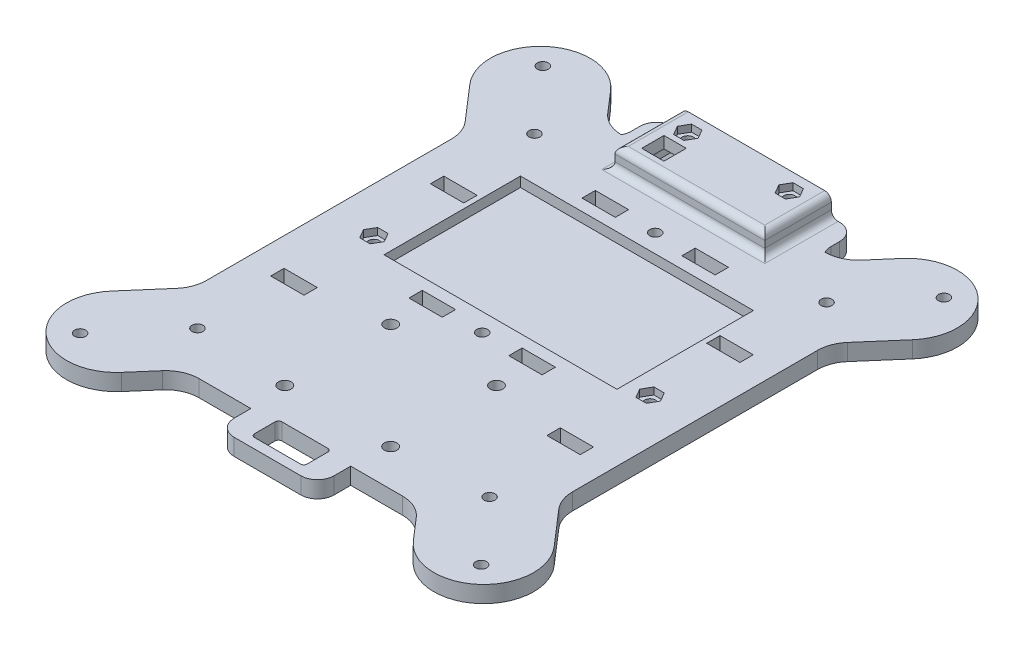
from build123d import *

# Parameters (mm, degrees)
SKETCH1_W                  = 110
SKETCH1_H                  = 126.923076924
BOSS_EXTRUDE1_DEPTH        = 5
CUT_EXTRUDE1_DEPTH         = 2.1
F_3_3_3_3_DIAMETER_HOLE1_D = 3.3
SKETCH30_W                 = 60
SKETCH30_H                 = 10
BOSS_EXTRUDE6_DEPTH        = 5
SKETCH9_W                  = 45
SKETCH9_H                  = 20
BOSS_EXTRUDE2_DEPTH        = 6
FILLET1_RADIUS             = 15
FILLET1_LENGTH             = 5
FILLET2_RADIUS             = 15
FILLET2_LENGTH             = 5
FILLET3_RADIUS             = 15
FILLET3_LENGTH             = 5
FILLET4_RADIUS             = 15
FILLET4_LENGTH             = 5
FILLET5_R                  = 10
SKETCH16_W                 = 41
SKETCH16_H                 = 16
CUT_EXTRUDE13_DEPTH        = 7.5
SKETCH18_R                 = 1.7
SKETCH18_W                 = 6.7
SKETCH18_H                 = 6.7
CUT_EXTRUDE14_DEPTH        = 3.5
FILLET8_R                  = 2
FILLET9_R                  = 2
CUT_EXTRUDE20_REACH        = 169.893
BOSS_EXTRUDE7_DEPTH        = 16
CUT_EXTRUDE17_DEPTH        = 2.1
SKETCH28_W                 = 30
SKETCH28_H                 = 10
BOSS_EXTRUDE4_DEPTH        = 5
FILLET11_R                 = 5
SKETCH25_R                 = 1.9
SKETCH25_W                 = 15.8
SKETCH25_H                 = 8.2
CUT_EXTRUDE18_DEPTH        = 5
FILLET12_R                 = 1
FILLET13_R                 = 5
SKETCH32_W                 = 70
SKETCH32_H                 = 41
CUT_EXTRUDE25_DEPTH        = 3
SKETCH43_R                 = 1.65
SKETCH43_W                 = 10
SKETCH43_H                 = 4
CUT_EXTRUDE26_DEPTH        = 5
CUT_EXTRUDE27_DEPTH        = 2.1
SKETCH48_R                 = 1.65
SKETCH48_W                 = 10
SKETCH48_H                 = 4
CUT_EXTRUDE28_DEPTH        = 5
CUT_EXTRUDE29_DEPTH        = 2.1


with BuildPart() as part:
    # Sketch1 → Boss-Extrude1 (new body)
    with BuildSketch(Plane(origin=(0, 0, 0), x_dir=(1, 0, 0), z_dir=(0, 1, 0))):
        Polygon((-76.335336242, 65.176041924), (-53.664663758, 84.823958076), (76.335336242, -65.176041924), (53.664663758, -84.823958076), align=None)
        Rectangle(SKETCH1_W, SKETCH1_H)
        Polygon((53.664663758, 84.823958076), (76.335336242, 65.176041924), (-53.664663758, -84.823958076), (-76.335336242, -65.176041924), align=None)
    extrude(amount=BOSS_EXTRUDE1_DEPTH)

    # Sketch2 → Cut-Extrude1 (cut)
    with BuildSketch(Plane.XZ):
        Polygon((-61.273034387, -66.577080465), (-63.314905729, -68.93308586), (-62.295480877, -71.879401012), (-59.234184682, -72.469710768), (-57.19231334, -70.113705373), (-58.211738192, -67.167390222), align=None)
        Polygon((-41.838474732, -48.275163152), (-44.899770926, -47.684853396), (-46.941642269, -50.040858791), (-45.922217416, -52.987173942), (-42.860921222, -53.577483698), (-40.819049879, -51.221478303), align=None)
        Polygon((44.899770926, -47.684853396), (41.838474732, -48.275163152), (40.819049879, -51.221478303), (42.860921222, -53.577483698), (45.922217416, -52.987173942), (46.941642269, -50.040858791), align=None)
        Polygon((58.211738192, -67.167390222), (57.19231334, -70.113705373), (59.234184682, -72.469710768), (62.295480877, -71.879401012), (63.314905729, -68.93308586), (61.273034387, -66.577080465), align=None)
        Polygon((62.295480877, 71.879401012), (59.234184682, 72.469710768), (57.19231334, 70.113705373), (58.211738192, 67.167390222), (61.273034387, 66.577080465), (63.314905729, 68.93308586), align=None)
        Polygon((42.860921222, 53.577483698), (40.819049879, 51.221478303), (41.838474732, 48.275163152), (44.899770926, 47.684853396), (46.941642269, 50.040858791), (45.922217416, 52.987173942), align=None)
        Polygon((-42.860921222, 53.577483698), (-45.922217416, 52.987173942), (-46.941642269, 50.040858791), (-44.899770926, 47.684853396), (-41.838474732, 48.275163152), (-40.819049879, 51.221478303), align=None)
        Polygon((-59.234184682, 72.469710768), (-62.295480877, 71.879401012), (-63.314905729, 68.93308586), (-61.273034387, 66.577080465), (-58.211738192, 67.167390222), (-57.19231334, 70.113705373), align=None)
    extrude(amount=-CUT_EXTRUDE1_DEPTH, mode=Mode.SUBTRACT)

    # Ø3.3 (3.3) Diameter Hole1 (through all)
    with Locations(Plane(origin=(-60.253609534, 0, -69.523395617), x_dir=(0, 0, -1), z_dir=(0, -1, 0))):
        with Locations((0, 0), (-18.89222707, 16.37326346), (-18.89222707, 104.133955608), (0, 120.507219068), (-120.154564164, 104.133955608), (-139.046791234, 120.507219068), (-139.046791234, 0), (-120.154564164, 16.37326346)):
            Hole(F_3_3_3_3_DIAMETER_HOLE1_D / 2)

    # Sketch30 → Boss-Extrude6 (add)
    with BuildSketch(Plane(origin=(0, 5, 0), x_dir=(1, 0, 0), z_dir=(0, 1, 0))):
        with Locations((0, 68.461538462)):
            Rectangle(SKETCH30_W, SKETCH30_H)
    extrude(amount=-BOSS_EXTRUDE6_DEPTH)

    # Sketch9 → Boss-Extrude2 (add)
    with BuildSketch(Plane(origin=(0, 5, 0), x_dir=(1, 0, 0), z_dir=(0, 1, 0))):
        with Locations((0, 63.461538462)):
            Rectangle(SKETCH9_W, SKETCH9_H)
    extrude(amount=BOSS_EXTRUDE2_DEPTH)

    # Fillet1: full round fillet: the end face becomes a half cylinder, R = half its width
    fillet1_face = Plane((65, 2.5, -75), x_dir=(0, 1, 0), z_dir=(0.654930538418, 0, -0.75568908279))  # on the end face: x along it, z out of the body
    fillet1_slab = fillet1_face.offset(-FILLET1_RADIUS / 2) * Box(FILLET1_LENGTH, 2 * FILLET1_RADIUS, FILLET1_RADIUS, mode=Mode.PRIVATE)  # the body's end, R deep
    fillet1_round = Plane((55.176041924, 2.5, -63.664663758), x_dir=(0.654930538418, 0, -0.75568908279), z_dir=(0, 1, 0)) * Cylinder(FILLET1_RADIUS, FILLET1_LENGTH, mode=Mode.PRIVATE)  # its axis R under the face
    add(fillet1_slab - fillet1_round, mode=Mode.SUBTRACT)

    # Fillet2: full round fillet: the end face becomes a half cylinder, R = half its width
    fillet2_face = Plane((-65, 2.5, -75), x_dir=(0, 1, 0), z_dir=(-0.654930538418, 0, -0.75568908279))  # on the end face: x along it, z out of the body
    fillet2_slab = fillet2_face.offset(-FILLET2_RADIUS / 2) * Box(FILLET2_LENGTH, 2 * FILLET2_RADIUS, FILLET2_RADIUS, mode=Mode.PRIVATE)  # the body's end, R deep
    fillet2_round = Plane((-55.176041924, 2.5, -63.664663758), x_dir=(-0.654930538418, 0, -0.75568908279), z_dir=(0, 1, 0)) * Cylinder(FILLET2_RADIUS, FILLET2_LENGTH, mode=Mode.PRIVATE)  # its axis R under the face
    add(fillet2_slab - fillet2_round, mode=Mode.SUBTRACT)

    # Fillet3: full round fillet: the end face becomes a half cylinder, R = half its width
    fillet3_face = Plane((-65, 2.5, 75), x_dir=(0, 1, 0), z_dir=(-0.654930538418, 0, 0.75568908279))  # on the end face: x along it, z out of the body
    fillet3_slab = fillet3_face.offset(-FILLET3_RADIUS / 2) * Box(FILLET3_LENGTH, 2 * FILLET3_RADIUS, FILLET3_RADIUS, mode=Mode.PRIVATE)  # the body's end, R deep
    fillet3_round = Plane((-55.176041924, 2.5, 63.664663758), x_dir=(-0.654930538418, 0, 0.75568908279), z_dir=(0, 1, 0)) * Cylinder(FILLET3_RADIUS, FILLET3_LENGTH, mode=Mode.PRIVATE)  # its axis R under the face
    add(fillet3_slab - fillet3_round, mode=Mode.SUBTRACT)

    # Fillet4: full round fillet: the end face becomes a half cylinder, R = half its width
    fillet4_face = Plane((65, 2.5, 75), x_dir=(0, 1, 0), z_dir=(0.654930538418, 0, 0.75568908279))  # on the end face: x along it, z out of the body
    fillet4_slab = fillet4_face.offset(-FILLET4_RADIUS / 2) * Box(FILLET4_LENGTH, 2 * FILLET4_RADIUS, FILLET4_RADIUS, mode=Mode.PRIVATE)  # the body's end, R deep
    fillet4_round = Plane((55.176041924, 2.5, 63.664663758), x_dir=(0.654930538418, 0, 0.75568908279), z_dir=(0, 1, 0)) * Cylinder(FILLET4_RADIUS, FILLET4_LENGTH, mode=Mode.PRIVATE)  # its axis R under the face
    add(fillet4_slab - fillet4_round, mode=Mode.SUBTRACT)

    # Fillet5
    fillet5_edges = [part.edges().sort_by_distance(p)[0] for p in [
        (-35.150566759, 2.5, -63.461538462),
        (35.150566759, 2.5, -63.461538462),
        (55, 2.5, -40.55834626),
        (55, 2.5, 40.55834626),
        (35.150566759, 2.5, 63.461538462),
        (-55, 2.5, -40.55834626),
        (-35.150566759, 2.5, 63.461538462),
        (-55, 2.5, 40.55834626),
    ]]
    fillet(fillet5_edges, radius=FILLET5_R)

    # Sketch16 → Cut-Extrude13 (cut)
    with BuildSketch(Plane.XZ):
        with Locations((0, -63.461538462)):
            Rectangle(SKETCH16_W, SKETCH16_H)
    extrude(amount=-CUT_EXTRUDE13_DEPTH, mode=Mode.SUBTRACT)

    # Sketch18 → Cut-Extrude14 (cut)
    with BuildSketch(Plane.XZ.offset(-7.5)):
        with Locations(Location((-15.25, -68.061538462, 0), (0, 0, 270))):
            Circle(SKETCH18_R)
        with Locations(Location((15.25, -68.061538462, 0), (0, 0, 270))):
            Circle(SKETCH18_R)
        with Locations((-14.65, -60.311538462)):
            Rectangle(SKETCH18_W, SKETCH18_H)
    extrude(amount=-CUT_EXTRUDE14_DEPTH, mode=Mode.SUBTRACT)

    # Fillet8
    fillet8_edges = [part.edges().sort_by_distance(p)[0] for p in [
        (22.5, 11, -63.461538462),
        (-22.5, 11, -63.461538462),
        (0, 11, -53.461538462),
    ]]
    fillet(fillet8_edges, radius=FILLET8_R)

    # Fillet9
    fillet9_edges = [part.edges().sort_by_distance(p)[0] for p in [
        (22.5, 5, -63.461538462),
        (-22.5, 5, -63.461538462),
        (0, 5, -53.461538462),
    ]]
    fillet(fillet9_edges, radius=FILLET9_R)

    # Cut-Extrude20: up to this face of the body (flat: up to its plane)
    cut_extrude20_end = Plane(part.part.faces().sort_by_distance((0, 3.75, -55.461538462))[0])
    # Sketch20 → Cut-Extrude20 (cut, up to the picked face)
    with BuildSketch(Plane(origin=(0, 0, -73.461538462), x_dir=(-1, 0, 0), z_dir=(0, 0, -1)), mode=Mode.PRIVATE) as cut_extrude20_sk1:
        Polygon((-19.5, 0), (19.5, 0), (22.5, 3), (-22.5, 3), align=None)
    cut_extrude20_tool1 = split(extrude(cut_extrude20_sk1.sketch, amount=-CUT_EXTRUDE20_REACH, mode=Mode.PRIVATE), bisect_by=cut_extrude20_end, keep=Keep.BOTH, mode=Mode.PRIVATE)
    add(cut_extrude20_tool1.solids().sort_by(Axis((0, 1.535714, -73.461538), (0, 0, 1)))[0], mode=Mode.SUBTRACT)

    # Sketch31 → Boss-Extrude7 (add)
    with BuildSketch(Plane.XY.offset(-71.461538462)):
        Polygon((20.5, 0), (20.5, 1), (19.5, 0), align=None)
        Polygon((-20.5, 0), (-19.5, 0), (-20.5, 1), align=None)
    extrude(amount=BOSS_EXTRUDE7_DEPTH)

    # Sketch24 → Cut-Extrude17 (cut)
    with BuildSketch(Plane(origin=(0, 11, 0), x_dir=(1, 0, 0), z_dir=(0, 1, 0))):
        Polygon((-13.691154273, 70.761538462), (-16.808845727, 70.761538462), (-18.367691454, 68.061538462), (-16.808845727, 65.361538462), (-13.691154273, 65.361538462), (-12.132308546, 68.061538462), align=None)
        Polygon((16.808845727, 70.761538462), (13.691154273, 70.761538462), (12.132308546, 68.061538462), (13.691154273, 65.361538462), (16.808845727, 65.361538462), (18.367691454, 68.061538462), align=None)
    extrude(amount=-CUT_EXTRUDE17_DEPTH, mode=Mode.SUBTRACT)

    # Sketch28 → Boss-Extrude4 (add)
    with BuildSketch(Plane(origin=(0, 5, 0), x_dir=(1, 0, 0), z_dir=(0, 1, 0))):
        with Locations((0, -68.461538462)):
            Rectangle(SKETCH28_W, SKETCH28_H)
    extrude(amount=-BOSS_EXTRUDE4_DEPTH)

    # Fillet11
    fillet11_edges = [part.edges().sort_by_distance(p)[0] for p in [
        (-15, 2.5, 73.461538462),
        (15, 2.5, 73.461538462),
    ]]
    fillet(fillet11_edges, radius=FILLET11_R)

    # Sketch25 → Cut-Extrude18 (cut)
    with BuildSketch(Plane(origin=(0, 5, 0), x_dir=(1, 0, 0), z_dir=(0, 1, 0))):
        with Locations(Location((-15.9, -20.561538462, 0), (0, 0, 270))):
            Circle(SKETCH25_R)
        with Locations(Location((15.9, -20.561538462, 0), (0, 0, 270))):
            Circle(SKETCH25_R)
        with Locations(Location((-15.9, -52.361538462, 0), (0, 0, 270))):
            Circle(SKETCH25_R)
        with Locations(Location((15.9, -52.361538462, 0), (0, 0, 270))):
            Circle(SKETCH25_R)
        with Locations((0, -66.361538462)):
            Rectangle(SKETCH25_W, SKETCH25_H)
    extrude(amount=-CUT_EXTRUDE18_DEPTH, mode=Mode.SUBTRACT)

    # Fillet12
    fillet12_edges = [part.edges().sort_by_distance(p)[0] for p in [
        (7.9, 2.5, 62.261538462),
        (7.9, 2.5, 70.461538462),
        (-7.9, 2.5, 70.461538462),
        (-7.9, 2.5, 62.261538462),
    ]]
    fillet(fillet12_edges, radius=FILLET12_R)

    # Fillet13
    # the kernel refuses this fillet: 5 mm, written as the material it adds along each edge
    with BuildSketch(Plane(origin=(-30, 5, -63.461538462), x_dir=(-1, 0, 0), z_dir=(0, -1, 0))) as fillet13_piece_1:
        with BuildLine():
            CenterArc((5, 2.345506046), FILLET13_R, 180, 27.975969883)
            Line((0, 2.345506046), (0, 0))
            Line((0, 0), (0.584277931, 0))
        make_face()
    extrude(amount=5)
    with BuildSketch(Plane(origin=(30, 5, -63.461538462), x_dir=(1, 0, 0), z_dir=(0, -1, 0))) as fillet13_piece_2:
        with BuildLine():
            CenterArc((5, -2.345506046), FILLET13_R, 152.024030117, 27.975969883)
            Line((0, -2.345506046), (0, 0))
            Line((0, 0), (0.584277931, 0))
        make_face()
    extrude(amount=5)
    # the kernel refuses this fillet: 5 mm, written as the material it takes off along each edge
    with BuildSketch(Plane(origin=(30, 17.5, -73.461538462), x_dir=(0, 0, 1), z_dir=(0, -1, 0)), Plane(origin=(-30, 17.5, -73.461538462), x_dir=(1, 0, 0), z_dir=(0, -1, 0))) as fillet13_2_piece_1:
        with BuildLine():
            CenterArc((FILLET13_R, FILLET13_R), FILLET13_R, 180, 90)
            Line((0, FILLET13_R), (0, 0))
            Line((0, 0), (FILLET13_R, 0))
        make_face()
    extrude(amount=30, mode=Mode.SUBTRACT)

    # Sketch32 → Cut-Extrude25 (cut)
    with BuildSketch(Plane(origin=(0, 5, 0), x_dir=(1, 0, 0), z_dir=(0, 1, 0))):
        with Locations((0, 17.038461538)):
            Rectangle(SKETCH32_W, SKETCH32_H)
    extrude(amount=-CUT_EXTRUDE25_DEPTH, mode=Mode.SUBTRACT)

    # Sketch43 → Cut-Extrude26 (cut)
    with BuildSketch(Plane(origin=(0, 5, 0), x_dir=(1, 0, 0), z_dir=(0, 1, 0))):
        with Locations(Location((0, -8.961538462, 0), (0, 0, 270))):
            Circle(SKETCH43_R)
        with Locations(Location((0, 43.038461538, 0), (0, 0, 270))):
            Circle(SKETCH43_R)
        with Locations((-15, 43.038461538)):
            Rectangle(SKETCH43_W, SKETCH43_H)
        with Locations((15, 43.038461538)):
            Rectangle(SKETCH43_W, SKETCH43_H)
        with Locations((-15, -8.961538462)):
            Rectangle(SKETCH43_W, SKETCH43_H)
        with Locations((15, -8.961538462)):
            Rectangle(SKETCH43_W, SKETCH43_H)
    extrude(amount=-CUT_EXTRUDE26_DEPTH, mode=Mode.SUBTRACT)

    # Sketch44 → Cut-Extrude27 (cut)
    with BuildSketch(Plane.XZ):
        Polygon((2.7, 7.402692735), (2.7, 10.520384188), (0, 12.079229915), (-2.7, 10.520384188), (-2.7, 7.402692735), (0, 5.843847008), align=None)
        Polygon((2.7, -44.597307265), (2.7, -41.479615812), (0, -39.920770085), (-2.7, -41.479615812), (-2.7, -44.597307265), (0, -46.156152992), align=None)
    extrude(amount=-CUT_EXTRUDE27_DEPTH, mode=Mode.SUBTRACT)

    # Sketch48 → Cut-Extrude28 (cut)
    with BuildSketch(Plane(origin=(0, 0, 0), x_dir=(1, 0, 0), z_dir=(0, 1, 0))):
        with Locations(Location((41.5, 0, 0), (0, 0, 270))):
            Circle(SKETCH48_R)
        with Locations(Location((-41.5, 0, 0), (0, 0, 270))):
            Circle(SKETCH48_R)
        with Locations((41.5, 24)):
            Rectangle(SKETCH48_W, SKETCH48_H)
        with Locations((41.5, -24)):
            Rectangle(SKETCH48_W, SKETCH48_H)
        with Locations((-41.5, 24)):
            Rectangle(SKETCH48_W, SKETCH48_H)
        with Locations((-41.5, -24)):
            Rectangle(SKETCH48_W, SKETCH48_H)
    extrude(amount=CUT_EXTRUDE28_DEPTH, mode=Mode.SUBTRACT)

    # Sketch49 → Cut-Extrude29 (cut)
    with BuildSketch(Plane(origin=(0, 5, 0), x_dir=(1, 0, 0), z_dir=(0, 1, 0))):
        Polygon((-39.941154273, 2.7), (-43.058845727, 2.7), (-44.617691454, 0), (-43.058845727, -2.7), (-39.941154273, -2.7), (-38.382308546, 0), align=None)
        Polygon((43.058845727, 2.7), (39.941154273, 2.7), (38.382308546, 0), (39.941154273, -2.7), (43.058845727, -2.7), (44.617691454, 0), align=None)
    extrude(amount=-CUT_EXTRUDE29_DEPTH, mode=Mode.SUBTRACT)


solid = part.part
